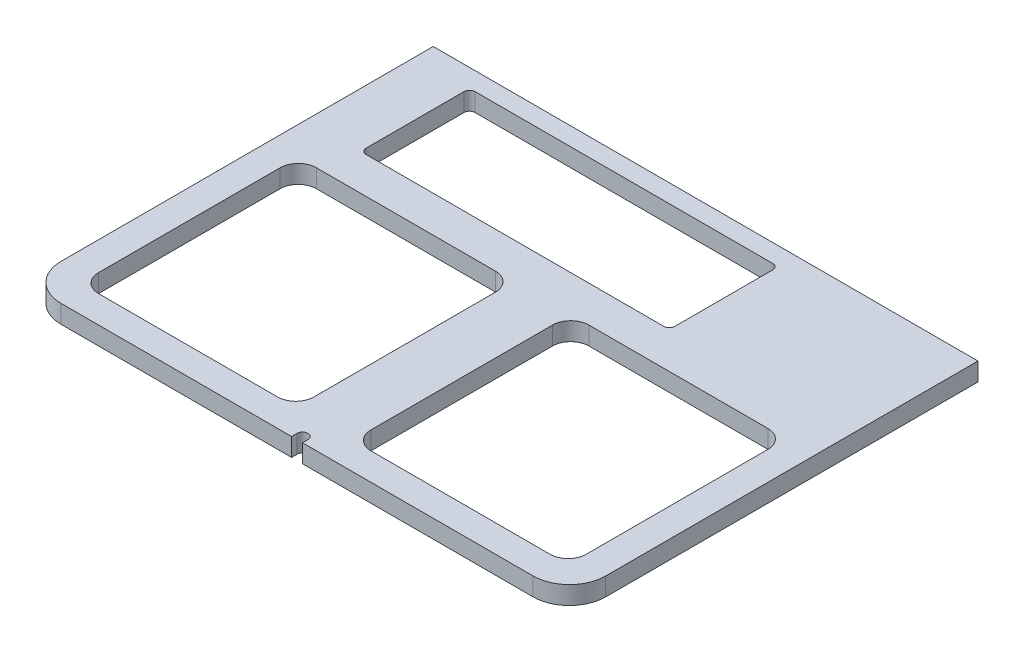
from build123d import *

# Parameters (mm, degrees)
SKIZZE1_W                       = 118.594243104
SKIZZE1_H                       = 120
LINEAR_AUSTRAGEN1_DEPTH         = 10
VERRUNDUNG2_R                   = 10
VERRUNDUNG2_OF_SPIEGELN1_R      = 10
SKIZZE3_W                       = 170
SKIZZE3_H                       = 60
SCHNITT_LINEAR_AUSTRAGEN1_DEPTH = 10
VERRUNDUNG3_R                   = 3
SCHNITT_LINEAR_AUSTRAGEN2_DEPTH = 10


with BuildPart() as part:
    # Skizze1 → Linear austragen1 (new body)
    with BuildSketch(Plane(origin=(0, 10, 0), x_dir=(1, 0, 0), z_dir=(0, 1, 0))):
        with BuildLine():
            Line((0, -75), (130, -75))
            ThreePointArc((130, -75), (144.142135624, -69.142135624), (150, -55))
            Line((150, -55), (150, 75.702878448))
            Line((150, 75.702878448), (150, 150))
            Line((150, 150), (0, 150))
            Line((0, 150), (0, 75.702878448))
            Line((0, 75.702878448), (0, -75))
        make_face()
        with Locations((75, 0)):
            Rectangle(SKIZZE1_W, SKIZZE1_H, mode=Mode.SUBTRACT)
    linear_austragen1 = extrude(amount=LINEAR_AUSTRAGEN1_DEPTH)

    # Verrundung2
    verrundung2_edges = [part.edges().sort_by_distance(p)[0] for p in [
        (15.702878448, 15, 60),
        (134.297121552, 15, 60),
        (134.297121552, 15, -60),
        (15.702878448, 15, -60),
    ]]
    fillet(verrundung2_edges, radius=VERRUNDUNG2_R)

    # Spiegeln1: Linear austragen1 across plane
    add(linear_austragen1.mirror(Plane(origin=(0, 20, -150), x_dir=(0, 0, 1), z_dir=(1, 0, 0))))

    # Verrundung2 of Spiegeln1
    verrundung2_of_spiegeln1_edges = [part.edges().sort_by_distance(p)[0] for p in [
        (-15.702878448, 15, 60),
        (-134.297121552, 15, 60),
        (-134.297121552, 15, -60),
        (-15.702878448, 15, -60),
    ]]
    fillet(verrundung2_of_spiegeln1_edges, radius=VERRUNDUNG2_OF_SPIEGELN1_R)

    # Skizze3 → Schnitt-Linear austragen1 (cut)
    with BuildSketch(Plane.XZ.offset(-10)):
        with Locations((-35, -110)):
            Rectangle(SKIZZE3_W, SKIZZE3_H)
    extrude(amount=-SCHNITT_LINEAR_AUSTRAGEN1_DEPTH, mode=Mode.SUBTRACT)

    # Verrundung3
    verrundung3_edges = [part.edges().sort_by_distance(p)[0] for p in [
        (-120, 15, -140),
        (50, 15, -140),
        (50, 15, -80),
        (-120, 15, -80),
    ]]
    fillet(verrundung3_edges, radius=VERRUNDUNG3_R)

    # Skizze4 → Schnitt-Linear austragen2 (cut)
    with BuildSketch(Plane.XZ.offset(-10)):
        with BuildLine():
            Line((-3.000050853, 75), (-3.000050853, 72))
            ThreePointArc((-3.000050853, 72), (0.008683003, 69.000012713), (2.999898294, 72.017467638))
            Line((2.999898294, 72.017467638), (2.982532068, 75))
            Line((2.982532068, 75), (-3.000050853, 75))
        make_face()
    extrude(amount=-SCHNITT_LINEAR_AUSTRAGEN2_DEPTH, mode=Mode.SUBTRACT)


solid = part.part
